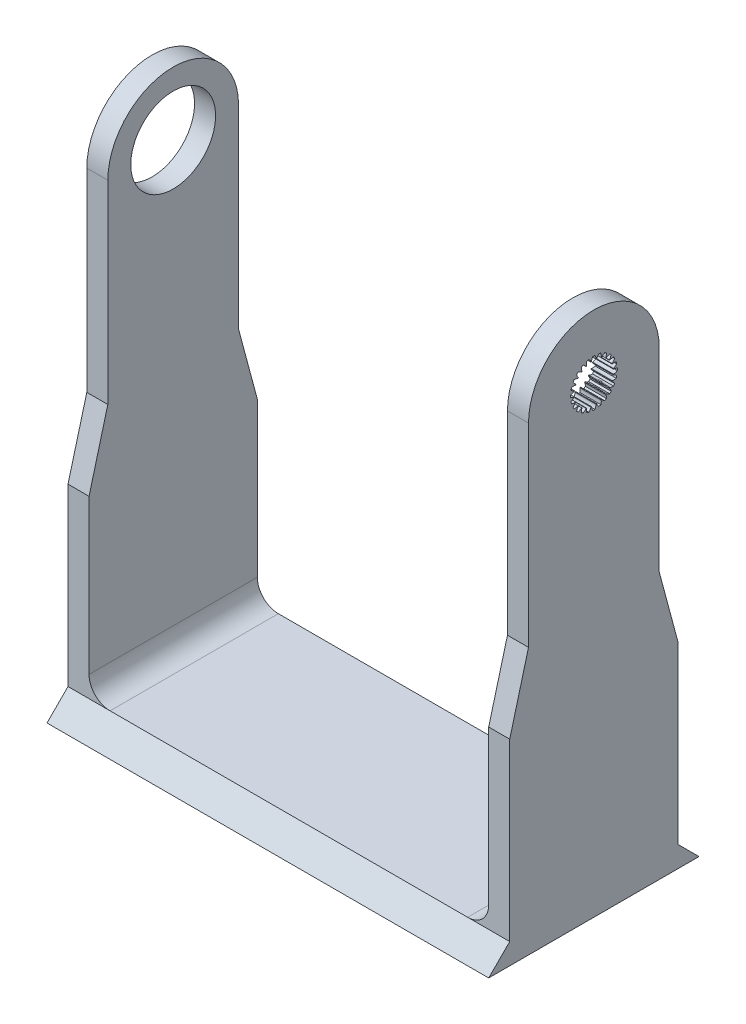
from build123d import *

# Parameters (mm, degrees)
SKETCH1_W           = 63
SKETCH1_H           = 30
BOSS_EXTRUDE1_DEPTH = 3
SKETCH2_W           = 3
SKETCH2_H           = 24
BOSS_EXTRUDE2_DEPTH = 75
CUT_EXTRUDE1_DEPTH  = 3
SKETCH4_R           = 6.05
CUT_EXTRUDE2_DEPTH  = 3
CHAMFER1_SIZE       = 3
FILLET1_R           = 3
CUT_EXTRUDE3_DEPTH  = 10


with BuildPart() as part:
    # Sketch1 → Boss-Extrude1 (new body)
    with BuildSketch(Plane(origin=(0, 0, 0), x_dir=(1, 0, 0), z_dir=(0, 1, 0))):
        Rectangle(SKETCH1_W, SKETCH1_H)
    extrude(amount=BOSS_EXTRUDE1_DEPTH)

    # Sketch2 → Boss-Extrude2 (add)
    with BuildSketch(Plane(origin=(0, 3, 0), x_dir=(1, 0, 0), z_dir=(0, 1, 0))):
        with Locations((-30, 0)):
            Rectangle(SKETCH2_W, SKETCH2_H)
        with Locations((30, 0)):
            Rectangle(SKETCH2_W, SKETCH2_H)
    extrude(amount=BOSS_EXTRUDE2_DEPTH)

    # Sketch3 → Cut-Extrude1 (cut)
    with BuildSketch(Plane(origin=(31.5, 0, 0), x_dir=(0, 0, -1), z_dir=(1, 0, 0))):
        with BuildLine():
            Line((-2.567781291, 64.883532696), (-2.589493644, 64.87315501))
            add(Edge.make_bspline(
                [(-2.589493644, 64.87315501), (-2.672261019, 64.826873884), (-2.739520857, 64.760726469), (-2.862009689, 64.618170383), (-2.91365439, 64.539190073), (-2.963486529, 64.459432705)],
                knots=[0, 0, 0, 0, 0.5, 0.5, 1, 1, 1, 1], degree=3))
            ThreePointArc((-2.963486529, 64.459432705), (-2.892524849, 64.33), (-2.815913678, 64.203829029))
            add(Edge.make_bspline(
                [(-2.815913678, 64.203829029), (-2.722016601, 64.207103074), (-2.627961448, 64.212323851), (-2.443262519, 64.247065096), (-2.35159405, 64.272611154), (-2.27062321, 64.320855217)],
                knots=[0, 0, 0, 0, 0.5, 0.5, 1, 1, 1, 1], degree=3))
            Line((-2.27062321, 64.320855217), (-2.250779693, 64.334469822))
            ThreePointArc((-2.250779693, 64.334469822), (-2.221389353, 64.295467999), (-2.191323264, 64.256984695))
            Line((-2.191323264, 64.256984695), (-2.209609843, 64.24134105))
            add(Edge.make_bspline(
                [(-2.209609843, 64.24134105), (-2.277578551, 64.175215142), (-2.325426356, 64.093913518), (-2.406845252, 63.92451247), (-2.436288594, 63.834856717), (-2.463780018, 63.744919509)],
                knots=[0, 0, 0, 0, 0.5, 0.5, 1, 1, 1, 1], degree=3))
            ThreePointArc((-2.463780018, 63.744919509), (-2.361736649, 63.638263351), (-2.255080491, 63.536219982))
            add(Edge.make_bspline(
                [(-2.255080491, 63.536219982), (-2.165230264, 63.563684818), (-2.075731199, 63.593070966), (-1.906317429, 63.674432033), (-1.824384294, 63.722833175), (-1.75865895, 63.790390157)],
                knots=[0, 0, 0, 0, 0.5, 0.5, 1, 1, 1, 1], degree=3))
            Line((-1.75865895, 63.790390157), (-1.743015305, 63.808676736))
            ThreePointArc((-1.743015305, 63.808676736), (-1.704532001, 63.778610647), (-1.665530178, 63.749220307))
            Line((-1.665530178, 63.749220307), (-1.679144783, 63.72937679))
            add(Edge.make_bspline(
                [(-1.679144783, 63.72937679), (-1.72768287, 63.647912473), (-1.752857891, 63.556997211), (-1.787658288, 63.372295603), (-1.792893756, 63.278074298), (-1.796170971, 63.184086322)],
                knots=[0, 0, 0, 0, 0.5, 0.5, 1, 1, 1, 1], degree=3))
            ThreePointArc((-1.796170971, 63.184086322), (-1.67, 63.107475151), (-1.540567295, 63.036513471))
            add(Edge.make_bspline(
                [(-1.540567295, 63.036513471), (-1.460887063, 63.086297416), (-1.3820433, 63.137846317), (-1.239459957, 63.260282583), (-1.172845764, 63.328240352), (-1.12684499, 63.410506356)],
                knots=[0, 0, 0, 0, 0.5, 0.5, 1, 1, 1, 1], degree=3))
            Line((-1.12684499, 63.410506356), (-1.116467304, 63.432218709))
            ThreePointArc((-1.116467304, 63.432218709), (-1.071513611, 63.413137309), (-1.026233962, 63.394842835))
            Line((-1.026233962, 63.394842835), (-1.034248782, 63.372151751))
            add(Edge.make_bspline(
                [(-1.034248782, 63.372151751), (-1.060048456, 63.280900681), (-1.060835058, 63.186567507), (-1.046645366, 62.999152448), (-1.027316172, 62.906786618), (-1.00615584, 62.815152998)],
                knots=[0, 0, 0, 0, 0.5, 0.5, 1, 1, 1, 1], degree=3))
            ThreePointArc((-1.00615584, 62.815152998), (-0.864455611, 62.77380774), (-0.721066984, 62.738763669))
            add(Edge.make_bspline(
                [(-0.721066984, 62.738763669), (-0.656986823, 62.807474029), (-0.594171433, 62.877672712), (-0.488135338, 63.032840348), (-0.441379733, 63.115723534), (-0.418238406, 63.207092268)],
                knots=[0, 0, 0, 0, 0.5, 0.5, 1, 1, 1, 1], degree=3))
            Line((-0.418238406, 63.207092268), (-0.413833901, 63.230750733))
            ThreePointArc((-0.413833901, 63.230750733), (-0.365473338, 63.223954388), (-0.317001598, 63.218002519))
            Line((-0.317001598, 63.218002519), (-0.318870434, 63.194010226))
            add(Edge.make_bspline(
                [(-0.318870434, 63.194010226), (-0.320173491, 63.099191014), (-0.296518068, 63.007868578), (-0.234305292, 62.830512095), (-0.191728688, 62.746296317), (-0.147572851, 62.663261734)],
                knots=[0, 0, 0, 0, 0.5, 0.5, 1, 1, 1, 1], degree=3))
            ThreePointArc((-0.147572851, 62.663261734), (0, 62.66), (0.147572851, 62.663261734))
            add(Edge.make_bspline(
                [(0.147572851, 62.663261734), (0.191685984, 62.746216011), (0.234192235, 62.830280551), (0.296454898, 63.007605139), (0.320165598, 63.09976539), (0.318870434, 63.194010226)],
                knots=[0, 0, 0, 0, 0.5, 0.5, 1, 1, 1, 1], degree=3))
            Line((0.318870434, 63.194010226), (0.317001598, 63.218002519))
            ThreePointArc((0.317001598, 63.218002519), (0.365473338, 63.223954388), (0.413833901, 63.230750733))
            Line((0.413833901, 63.230750733), (0.418238406, 63.207092268))
            add(Edge.make_bspline(
                [(0.418238406, 63.207092268), (0.441520768, 63.115166686), (0.488006138, 63.03307846), (0.5940023, 62.877867104), (0.656924789, 62.807540546), (0.721066984, 62.738763669)],
                knots=[0, 0, 0, 0, 0.5, 0.5, 1, 1, 1, 1], degree=3))
            ThreePointArc((0.721066984, 62.738763669), (0.864455611, 62.77380774), (1.00615584, 62.815152998))
            add(Edge.make_bspline(
                [(1.00615584, 62.815152998), (1.027295707, 62.906697995), (1.046596089, 62.998899533), (1.060842223, 63.186296695), (1.059892172, 63.281453442), (1.034248782, 63.372151751)],
                knots=[0, 0, 0, 0, 0.5, 0.5, 1, 1, 1, 1], degree=3))
            Line((1.034248782, 63.372151751), (1.026233962, 63.394842835))
            ThreePointArc((1.026233962, 63.394842835), (1.071513611, 63.413137309), (1.116467304, 63.432218709))
            Line((1.116467304, 63.432218709), (1.12684499, 63.410506356))
            add(Edge.make_bspline(
                [(1.12684499, 63.410506356), (1.173126116, 63.327738981), (1.239273531, 63.260479143), (1.381829617, 63.137990311), (1.460809927, 63.08634561), (1.540567295, 63.036513471)],
                knots=[0, 0, 0, 0, 0.5, 0.5, 1, 1, 1, 1], degree=3))
            ThreePointArc((1.540567295, 63.036513471), (1.67, 63.107475151), (1.796170971, 63.184086322))
            add(Edge.make_bspline(
                [(1.796170971, 63.184086322), (1.792896926, 63.277983399), (1.787676149, 63.372038552), (1.752934904, 63.556737481), (1.727388846, 63.64840595), (1.679144783, 63.72937679)],
                knots=[0, 0, 0, 0, 0.5, 0.5, 1, 1, 1, 1], degree=3))
            Line((1.679144783, 63.72937679), (1.665530178, 63.749220307))
            ThreePointArc((1.665530178, 63.749220307), (1.704532001, 63.778610647), (1.743015305, 63.808676736))
            Line((1.743015305, 63.808676736), (1.75865895, 63.790390157))
            add(Edge.make_bspline(
                [(1.75865895, 63.790390157), (1.824784858, 63.722421449), (1.906086482, 63.674573644), (2.07548753, 63.593154748), (2.165143283, 63.563711406), (2.255080491, 63.536219982)],
                knots=[0, 0, 0, 0, 0.5, 0.5, 1, 1, 1, 1], degree=3))
            ThreePointArc((2.255080491, 63.536219982), (2.361736649, 63.638263351), (2.463780018, 63.744919509))
            add(Edge.make_bspline(
                [(2.463780018, 63.744919509), (2.436315182, 63.834769736), (2.406929034, 63.924268801), (2.325567967, 64.093682571), (2.277166825, 64.175615706), (2.209609843, 64.24134105)],
                knots=[0, 0, 0, 0, 0.5, 0.5, 1, 1, 1, 1], degree=3))
            Line((2.209609843, 64.24134105), (2.191323264, 64.256984695))
            ThreePointArc((2.191323264, 64.256984695), (2.221389353, 64.295467999), (2.250779693, 64.334469822))
            Line((2.250779693, 64.334469822), (2.27062321, 64.320855217))
            add(Edge.make_bspline(
                [(2.27062321, 64.320855217), (2.352087527, 64.27231713), (2.443002789, 64.247142109), (2.627704397, 64.212341712), (2.721925702, 64.207106244), (2.815913678, 64.203829029)],
                knots=[0, 0, 0, 0, 0.5, 0.5, 1, 1, 1, 1], degree=3))
            ThreePointArc((2.815913678, 64.203829029), (2.892524849, 64.33), (2.963486529, 64.459432705))
            add(Edge.make_bspline(
                [(2.963486529, 64.459432705), (2.913702584, 64.539112937), (2.862153683, 64.6179567), (2.739717417, 64.760540043), (2.671759648, 64.827154236), (2.589493644, 64.87315501)],
                knots=[0, 0, 0, 0, 0.5, 0.5, 1, 1, 1, 1], degree=3))
            Line((2.589493644, 64.87315501), (2.567781291, 64.883532696))
            ThreePointArc((2.567781291, 64.883532696), (2.586862691, 64.928486389), (2.605157165, 64.973766038))
            Line((2.605157165, 64.973766038), (2.627848249, 64.965751218))
            add(Edge.make_bspline(
                [(2.627848249, 64.965751218), (2.719099319, 64.939951544), (2.813432493, 64.939164942), (3.000847552, 64.953354634), (3.093213382, 64.972683828), (3.184847002, 64.99384416)],
                knots=[0, 0, 0, 0, 0.5, 0.5, 1, 1, 1, 1], degree=3))
            ThreePointArc((3.184847002, 64.99384416), (3.22619226, 65.135544389), (3.261236331, 65.278933016))
            add(Edge.make_bspline(
                [(3.261236331, 65.278933016), (3.192525971, 65.343013177), (3.122327288, 65.405828567), (2.967159652, 65.511864662), (2.884276466, 65.558620267), (2.792907732, 65.581761594)],
                knots=[0, 0, 0, 0, 0.5, 0.5, 1, 1, 1, 1], degree=3))
            Line((2.792907732, 65.581761594), (2.769249267, 65.586166099))
            ThreePointArc((2.769249267, 65.586166099), (2.776045612, 65.634526662), (2.781997481, 65.682998402))
            Line((2.781997481, 65.682998402), (2.805989774, 65.681129566))
            add(Edge.make_bspline(
                [(2.805989774, 65.681129566), (2.900808986, 65.679826509), (2.992131422, 65.703481932), (3.169487905, 65.765694708), (3.253703683, 65.808271312), (3.336738266, 65.852427149)],
                knots=[0, 0, 0, 0, 0.5, 0.5, 1, 1, 1, 1], degree=3))
            ThreePointArc((3.336738266, 65.852427149), (3.34, 66), (3.336738266, 66.147572851))
            add(Edge.make_bspline(
                [(3.336738266, 66.147572851), (3.253783989, 66.191685984), (3.169719449, 66.234192235), (2.992394861, 66.296454898), (2.90023461, 66.320165598), (2.805989774, 66.318870434)],
                knots=[0, 0, 0, 0, 0.5, 0.5, 1, 1, 1, 1], degree=3))
            Line((2.805989774, 66.318870434), (2.781997481, 66.317001598))
            ThreePointArc((2.781997481, 66.317001598), (2.776045612, 66.365473338), (2.769249267, 66.413833901))
            Line((2.769249267, 66.413833901), (2.792907732, 66.418238406))
            add(Edge.make_bspline(
                [(2.792907732, 66.418238406), (2.884833314, 66.441520768), (2.96692154, 66.488006138), (3.122132896, 66.5940023), (3.192459454, 66.656924789), (3.261236331, 66.721066984)],
                knots=[0, 0, 0, 0, 0.5, 0.5, 1, 1, 1, 1], degree=3))
            ThreePointArc((3.261236331, 66.721066984), (3.22619226, 66.864455611), (3.184847002, 67.00615584))
            add(Edge.make_bspline(
                [(3.184847002, 67.00615584), (3.093302005, 67.027295707), (3.001100467, 67.046596089), (2.813703305, 67.060842223), (2.718546558, 67.059892172), (2.627848249, 67.034248782)],
                knots=[0, 0, 0, 0, 0.5, 0.5, 1, 1, 1, 1], degree=3))
            Line((2.627848249, 67.034248782), (2.605157165, 67.026233962))
            ThreePointArc((2.605157165, 67.026233962), (2.586862691, 67.071513611), (2.567781291, 67.116467304))
            Line((2.567781291, 67.116467304), (2.589493644, 67.12684499))
            add(Edge.make_bspline(
                [(2.589493644, 67.12684499), (2.672261019, 67.173126116), (2.739520857, 67.239273531), (2.862009689, 67.381829617), (2.91365439, 67.460809927), (2.963486529, 67.540567295)],
                knots=[0, 0, 0, 0, 0.5, 0.5, 1, 1, 1, 1], degree=3))
            ThreePointArc((2.963486529, 67.540567295), (2.892524849, 67.67), (2.815913678, 67.796170971))
            add(Edge.make_bspline(
                [(2.815913678, 67.796170971), (2.722016601, 67.792896926), (2.627961448, 67.787676149), (2.443262519, 67.752934904), (2.35159405, 67.727388846), (2.27062321, 67.679144783)],
                knots=[0, 0, 0, 0, 0.5, 0.5, 1, 1, 1, 1], degree=3))
            Line((2.27062321, 67.679144783), (2.250779693, 67.665530178))
            ThreePointArc((2.250779693, 67.665530178), (2.221389353, 67.704532001), (2.191323264, 67.743015305))
            Line((2.191323264, 67.743015305), (2.209609843, 67.75865895))
            add(Edge.make_bspline(
                [(2.209609843, 67.75865895), (2.277578551, 67.824784858), (2.325426356, 67.906086482), (2.406845252, 68.07548753), (2.436288594, 68.165143283), (2.463780018, 68.255080491)],
                knots=[0, 0, 0, 0, 0.5, 0.5, 1, 1, 1, 1], degree=3))
            ThreePointArc((2.463780018, 68.255080491), (2.361736649, 68.361736649), (2.255080491, 68.463780018))
            add(Edge.make_bspline(
                [(2.255080491, 68.463780018), (2.165230264, 68.436315182), (2.075731199, 68.406929034), (1.906317429, 68.325567967), (1.824384294, 68.277166825), (1.75865895, 68.209609843)],
                knots=[0, 0, 0, 0, 0.5, 0.5, 1, 1, 1, 1], degree=3))
            Line((1.75865895, 68.209609843), (1.743015305, 68.191323264))
            ThreePointArc((1.743015305, 68.191323264), (1.704532001, 68.221389353), (1.665530178, 68.250779693))
            Line((1.665530178, 68.250779693), (1.679144783, 68.27062321))
            add(Edge.make_bspline(
                [(1.679144783, 68.27062321), (1.72768287, 68.352087527), (1.752857891, 68.443002789), (1.787658288, 68.627704397), (1.792893756, 68.721925702), (1.796170971, 68.815913678)],
                knots=[0, 0, 0, 0, 0.5, 0.5, 1, 1, 1, 1], degree=3))
            ThreePointArc((1.796170971, 68.815913678), (1.67, 68.892524849), (1.540567295, 68.963486529))
            add(Edge.make_bspline(
                [(1.540567295, 68.963486529), (1.460887063, 68.913702584), (1.3820433, 68.862153683), (1.239459957, 68.739717417), (1.172845764, 68.671759648), (1.12684499, 68.589493644)],
                knots=[0, 0, 0, 0, 0.5, 0.5, 1, 1, 1, 1], degree=3))
            Line((1.12684499, 68.589493644), (1.116467304, 68.567781291))
            ThreePointArc((1.116467304, 68.567781291), (1.071513611, 68.586862691), (1.026233962, 68.605157165))
            Line((1.026233962, 68.605157165), (1.034248782, 68.627848249))
            add(Edge.make_bspline(
                [(1.034248782, 68.627848249), (1.060048456, 68.719099319), (1.060835058, 68.813432493), (1.046645366, 69.000847552), (1.027316172, 69.093213382), (1.00615584, 69.184847002)],
                knots=[0, 0, 0, 0, 0.5, 0.5, 1, 1, 1, 1], degree=3))
            ThreePointArc((1.00615584, 69.184847002), (0.864455611, 69.22619226), (0.721066984, 69.261236331))
            add(Edge.make_bspline(
                [(0.721066984, 69.261236331), (0.656986823, 69.192525971), (0.594171433, 69.122327288), (0.488135338, 68.967159652), (0.441379733, 68.884276466), (0.418238406, 68.792907732)],
                knots=[0, 0, 0, 0, 0.5, 0.5, 1, 1, 1, 1], degree=3))
            Line((0.418238406, 68.792907732), (0.413833901, 68.769249267))
            ThreePointArc((0.413833901, 68.769249267), (0.365473338, 68.776045612), (0.317001598, 68.781997481))
            Line((0.317001598, 68.781997481), (0.318870434, 68.805989774))
            add(Edge.make_bspline(
                [(0.318870434, 68.805989774), (0.320173491, 68.900808986), (0.296518068, 68.992131422), (0.234305292, 69.169487905), (0.191728688, 69.253703683), (0.147572851, 69.336738266)],
                knots=[0, 0, 0, 0, 0.5, 0.5, 1, 1, 1, 1], degree=3))
            ThreePointArc((0.147572851, 69.336738266), (0, 69.34), (-0.147572851, 69.336738266))
            add(Edge.make_bspline(
                [(-0.147572851, 69.336738266), (-0.191685984, 69.253783989), (-0.234192235, 69.169719449), (-0.296454898, 68.992394861), (-0.320165598, 68.90023461), (-0.318870434, 68.805989774)],
                knots=[0, 0, 0, 0, 0.5, 0.5, 1, 1, 1, 1], degree=3))
            Line((-0.318870434, 68.805989774), (-0.317001598, 68.781997481))
            ThreePointArc((-0.317001598, 68.781997481), (-0.365473338, 68.776045612), (-0.413833901, 68.769249267))
            Line((-0.413833901, 68.769249267), (-0.418238406, 68.792907732))
            add(Edge.make_bspline(
                [(-0.418238406, 68.792907732), (-0.441520768, 68.884833314), (-0.488006138, 68.96692154), (-0.5940023, 69.122132896), (-0.656924789, 69.192459454), (-0.721066984, 69.261236331)],
                knots=[0, 0, 0, 0, 0.5, 0.5, 1, 1, 1, 1], degree=3))
            ThreePointArc((-0.721066984, 69.261236331), (-0.864455611, 69.22619226), (-1.00615584, 69.184847002))
            add(Edge.make_bspline(
                [(-1.00615584, 69.184847002), (-1.027295707, 69.093302005), (-1.046596089, 69.001100467), (-1.060842223, 68.813703305), (-1.059892172, 68.718546558), (-1.034248782, 68.627848249)],
                knots=[0, 0, 0, 0, 0.5, 0.5, 1, 1, 1, 1], degree=3))
            Line((-1.034248782, 68.627848249), (-1.026233962, 68.605157165))
            ThreePointArc((-1.026233962, 68.605157165), (-1.071513611, 68.586862691), (-1.116467304, 68.567781291))
            Line((-1.116467304, 68.567781291), (-1.12684499, 68.589493644))
            add(Edge.make_bspline(
                [(-1.12684499, 68.589493644), (-1.173126116, 68.672261019), (-1.239273531, 68.739520857), (-1.381829617, 68.862009689), (-1.460809927, 68.91365439), (-1.540567295, 68.963486529)],
                knots=[0, 0, 0, 0, 0.5, 0.5, 1, 1, 1, 1], degree=3))
            ThreePointArc((-1.540567295, 68.963486529), (-1.67, 68.892524849), (-1.796170971, 68.815913678))
            add(Edge.make_bspline(
                [(-1.796170971, 68.815913678), (-1.792896926, 68.722016601), (-1.787676149, 68.627961448), (-1.752934904, 68.443262519), (-1.727388846, 68.35159405), (-1.679144783, 68.27062321)],
                knots=[0, 0, 0, 0, 0.5, 0.5, 1, 1, 1, 1], degree=3))
            Line((-1.679144783, 68.27062321), (-1.665530178, 68.250779693))
            ThreePointArc((-1.665530178, 68.250779693), (-1.704532001, 68.221389353), (-1.743015305, 68.191323264))
            Line((-1.743015305, 68.191323264), (-1.75865895, 68.209609843))
            add(Edge.make_bspline(
                [(-1.75865895, 68.209609843), (-1.824784858, 68.277578551), (-1.906086482, 68.325426356), (-2.07548753, 68.406845252), (-2.165143283, 68.436288594), (-2.255080491, 68.463780018)],
                knots=[0, 0, 0, 0, 0.5, 0.5, 1, 1, 1, 1], degree=3))
            ThreePointArc((-2.255080491, 68.463780018), (-2.361736649, 68.361736649), (-2.463780018, 68.255080491))
            add(Edge.make_bspline(
                [(-2.463780018, 68.255080491), (-2.436315182, 68.165230264), (-2.406929034, 68.075731199), (-2.325567967, 67.906317429), (-2.277166825, 67.824384294), (-2.209609843, 67.75865895)],
                knots=[0, 0, 0, 0, 0.5, 0.5, 1, 1, 1, 1], degree=3))
            Line((-2.209609843, 67.75865895), (-2.191323264, 67.743015305))
            ThreePointArc((-2.191323264, 67.743015305), (-2.221389353, 67.704532001), (-2.250779693, 67.665530178))
            Line((-2.250779693, 67.665530178), (-2.27062321, 67.679144783))
            add(Edge.make_bspline(
                [(-2.27062321, 67.679144783), (-2.352087527, 67.72768287), (-2.443002789, 67.752857891), (-2.627704397, 67.787658288), (-2.721925702, 67.792893756), (-2.815913678, 67.796170971)],
                knots=[0, 0, 0, 0, 0.5, 0.5, 1, 1, 1, 1], degree=3))
            ThreePointArc((-2.815913678, 67.796170971), (-2.892524849, 67.67), (-2.963486529, 67.540567295))
            add(Edge.make_bspline(
                [(-2.963486529, 67.540567295), (-2.913702584, 67.460887063), (-2.862153683, 67.3820433), (-2.739717417, 67.239459957), (-2.671759648, 67.172845764), (-2.589493644, 67.12684499)],
                knots=[0, 0, 0, 0, 0.5, 0.5, 1, 1, 1, 1], degree=3))
            Line((-2.589493644, 67.12684499), (-2.567781291, 67.116467304))
            ThreePointArc((-2.567781291, 67.116467304), (-2.586862691, 67.071513611), (-2.605157165, 67.026233962))
            Line((-2.605157165, 67.026233962), (-2.627848249, 67.034248782))
            add(Edge.make_bspline(
                [(-2.627848249, 67.034248782), (-2.719099319, 67.060048456), (-2.813432493, 67.060835058), (-3.000847552, 67.046645366), (-3.093213382, 67.027316172), (-3.184847002, 67.00615584)],
                knots=[0, 0, 0, 0, 0.5, 0.5, 1, 1, 1, 1], degree=3))
            ThreePointArc((-3.184847002, 67.00615584), (-3.22619226, 66.864455611), (-3.261236331, 66.721066984))
            add(Edge.make_bspline(
                [(-3.261236331, 66.721066984), (-3.192525971, 66.656986823), (-3.122327288, 66.594171433), (-2.967159652, 66.488135338), (-2.884276466, 66.441379733), (-2.792907732, 66.418238406)],
                knots=[0, 0, 0, 0, 0.5, 0.5, 1, 1, 1, 1], degree=3))
            Line((-2.792907732, 66.418238406), (-2.769249267, 66.413833901))
            ThreePointArc((-2.769249267, 66.413833901), (-2.776045612, 66.365473338), (-2.781997481, 66.317001598))
            Line((-2.781997481, 66.317001598), (-2.805989774, 66.318870434))
            add(Edge.make_bspline(
                [(-2.805989774, 66.318870434), (-2.900808986, 66.320173491), (-2.992131422, 66.296518068), (-3.169487905, 66.234305292), (-3.253703683, 66.191728688), (-3.336738266, 66.147572851)],
                knots=[0, 0, 0, 0, 0.5, 0.5, 1, 1, 1, 1], degree=3))
            ThreePointArc((-3.336738266, 66.147572851), (-3.34, 66), (-3.336738266, 65.852427149))
            add(Edge.make_bspline(
                [(-3.336738266, 65.852427149), (-3.253783989, 65.808314016), (-3.169719449, 65.765807765), (-2.992394861, 65.703545102), (-2.90023461, 65.679834402), (-2.805989774, 65.681129566)],
                knots=[0, 0, 0, 0, 0.5, 0.5, 1, 1, 1, 1], degree=3))
            Line((-2.805989774, 65.681129566), (-2.781997481, 65.682998402))
            ThreePointArc((-2.781997481, 65.682998402), (-2.776045612, 65.634526662), (-2.769249267, 65.586166099))
            Line((-2.769249267, 65.586166099), (-2.792907732, 65.581761594))
            add(Edge.make_bspline(
                [(-2.792907732, 65.581761594), (-2.884833314, 65.558479232), (-2.96692154, 65.511993862), (-3.122132896, 65.4059977), (-3.192459454, 65.343075211), (-3.261236331, 65.278933016)],
                knots=[0, 0, 0, 0, 0.5, 0.5, 1, 1, 1, 1], degree=3))
            ThreePointArc((-3.261236331, 65.278933016), (-3.22619226, 65.135544389), (-3.184847002, 64.99384416))
            add(Edge.make_bspline(
                [(-3.184847002, 64.99384416), (-3.093302005, 64.972704293), (-3.001100467, 64.953403911), (-2.813703305, 64.939157777), (-2.718546558, 64.940107828), (-2.627848249, 64.965751218)],
                knots=[0, 0, 0, 0, 0.5, 0.5, 1, 1, 1, 1], degree=3))
            Line((-2.627848249, 64.965751218), (-2.605157165, 64.973766038))
            ThreePointArc((-2.605157165, 64.973766038), (-2.586862691, 64.928486389), (-2.567781291, 64.883532696))
        make_face()
    extrude(amount=-CUT_EXTRUDE1_DEPTH, mode=Mode.SUBTRACT)

    # Sketch4 → Cut-Extrude2 (cut)
    with BuildSketch(Plane.ZY.offset(31.5)):
        with Locations((0, 66)):
            Circle(SKETCH4_R)
    extrude(amount=-CUT_EXTRUDE2_DEPTH, mode=Mode.SUBTRACT)

    # Chamfer1
    chamfer1_edges = [part.edges().sort_by_distance(p)[0] for p in [
        (0, 3, -15),
        (0, 3, 15),
    ]]
    chamfer(chamfer1_edges, length=CHAMFER1_SIZE - 0.0001)  # a hair under: the kernel refuses the full size

    # Fillet1
    fillet1_edges = [part.edges().sort_by_distance(p)[0] for p in [
        (-28.5, 3, 0),
        (28.5, 3, 0),
    ]]
    fillet(fillet1_edges, radius=FILLET1_R)

    # Sketch5 → Cut-Extrude3 (cut)
    with BuildSketch(Plane(origin=(31.5, 0, 0), x_dir=(0, 0, -1), z_dir=(1, 0, 0))):
        with BuildLine():
            Line((-9.320508076, 38), (-9.320508076, 65.7))
            ThreePointArc((-9.320508076, 65.7), (0, 75.020508076), (9.320508076, 65.7))
            Line((9.320508076, 65.7), (9.320508076, 38))
            Line((9.320508076, 38), (12, 28))
            Line((12, 28), (12, 78))
            Line((12, 78), (-12, 78))
            Line((-12, 78), (-12, 28))
            Line((-12, 28), (-9.320508076, 38))
        make_face()
    cut_extrude3 = extrude(amount=-CUT_EXTRUDE3_DEPTH, mode=Mode.SUBTRACT)

    # Mirror1: Cut-Extrude3 across plane
    add(cut_extrude3.mirror(Plane(origin=(0, 0, 0), x_dir=(0, 0, 1), z_dir=(1, 0, 0))), mode=Mode.SUBTRACT)


solid = part.part
